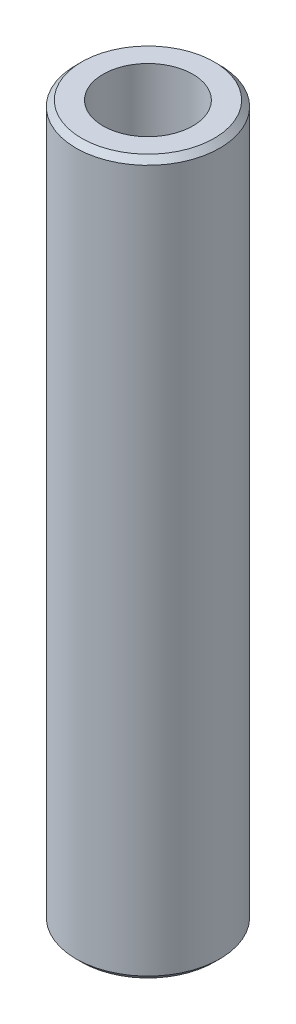
from build123d import *

# Parameters (mm, degrees)
SKETCH1_R           = 12.7
SKETCH1_R_2         = 7.9248
BOSS_EXTRUDE1_DEPTH = 63
CHAMFER1_SIZE       = 1


with BuildPart() as part:
    # Sketch1 → Boss-Extrude1 (new, symmetric)
    with BuildSketch(Plane(origin=(0, 0, 0), x_dir=(1, 0, 0), z_dir=(0, 1, 0))):
        Circle(SKETCH1_R)
        Circle(SKETCH1_R_2, mode=Mode.SUBTRACT)
    extrude(amount=BOSS_EXTRUDE1_DEPTH, both=True)

    # Chamfer1
    chamfer1_edges = [part.edges().sort_by_distance(p)[0] for p in [
        (-12.7, -63, 0),
        (-12.7, 63, 0),
    ]]
    chamfer(chamfer1_edges, length=CHAMFER1_SIZE)


solid = part.part
